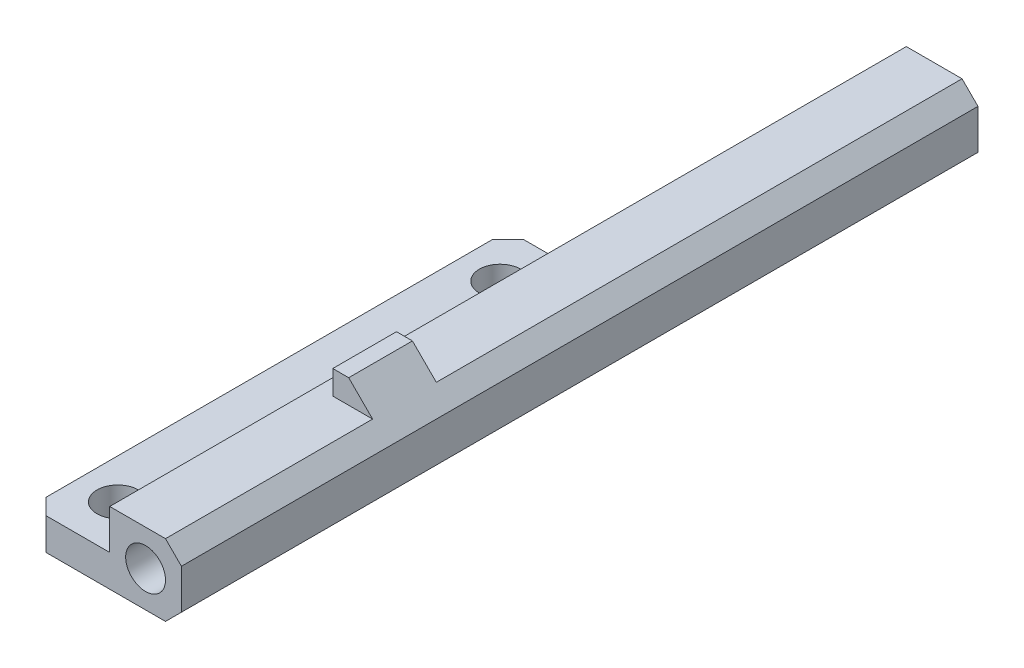
from build123d import *

# Parameters (mm, degrees)
SKETCH1_W           = 77.47
SKETCH1_H           = 127
BOSS_EXTRUDE1_DEPTH = 11.43
SKETCH2_R           = 3.175
CUT_EXTRUDE1_DEPTH  = 150.202030147
CUT_EXTRUDE2_DEPTH  = 150.202030147
SKETCH4_W           = 54.61
SKETCH4_H           = 6.35
CUT_EXTRUDE3_DEPTH  = 150.202030147
CHAMFER1_SIZE       = 2.54
SKETCH5_W           = 66.04
SKETCH5_H           = 50.8
CUT_EXTRUDE4_DEPTH  = 150.202030147
SKETCH6_W           = 53.34
SKETCH6_H           = 76.2
CUT_EXTRUDE5_DEPTH  = 150.202030147
SKETCH7_R           = 3.302
CUT_EXTRUDE6_DEPTH  = 149.899037606
CHAMFER2_SIZE       = 2.54
BOSS_EXTRUDE2_DEPTH = 5.08


with BuildPart() as part:
    # Sketch1 → Boss-Extrude1 (new body)
    with BuildSketch(Plane(origin=(0, 0, 0), x_dir=(1, 0, 0), z_dir=(0, 1, 0))):
        with Locations((38.735, 63.5)):
            Rectangle(SKETCH1_W, SKETCH1_H)
    extrude(amount=BOSS_EXTRUDE1_DEPTH)

    # Sketch2 → Cut-Extrude1 (cut, through all)
    with BuildSketch(Plane.XY):
        with Locations((5.715, 5.715)):
            Circle(SKETCH2_R)
        with Locations((71.755, 5.715)):
            Circle(SKETCH2_R)
    extrude(amount=-CUT_EXTRUDE1_DEPTH, mode=Mode.SUBTRACT)

    # Sketch3 → Cut-Extrude2 (cut, through all)
    with BuildSketch(Plane(origin=(0, 11.43, 0), x_dir=(1, 0, 0), z_dir=(0, 1, 0))):
        with BuildLine():
            Line((11.43, 127), (11.43, 88.9))
            ThreePointArc((11.43, 88.9), (15.149743879, 79.919743879), (24.13, 76.2))
            Line((24.13, 76.2), (53.34, 76.2))
            ThreePointArc((53.34, 76.2), (62.320256121, 79.919743879), (66.04, 88.9))
            Line((66.04, 88.9), (66.04, 127))
            Line((66.04, 127), (11.43, 127))
        make_face()
    extrude(amount=-CUT_EXTRUDE2_DEPTH, mode=Mode.SUBTRACT)

    # Sketch4 → Cut-Extrude3 (cut, through all)
    with BuildSketch(Plane(origin=(0, 0, -127), x_dir=(-1, 0, 0), z_dir=(0, 0, -1))):
        with Locations((-38.735, 8.255)):
            Rectangle(SKETCH4_W, SKETCH4_H)
    extrude(amount=-CUT_EXTRUDE3_DEPTH, mode=Mode.SUBTRACT)

    # Chamfer1
    chamfer1_edges = [part.edges().sort_by_distance(p)[0] for p in [
        (0, 0, -63.5),
        (0, 11.43, -63.5),
        (77.47, 0, -63.5),
        (77.47, 11.43, -63.5),
    ]]
    chamfer(chamfer1_edges, length=CHAMFER1_SIZE)

    # Sketch5 → Cut-Extrude4 (cut, through all)
    with BuildSketch(Plane(origin=(0, 11.43, 0), x_dir=(1, 0, 0), z_dir=(0, 1, 0))):
        with Locations((33.02, 101.6)):
            Rectangle(SKETCH5_W, SKETCH5_H)
    extrude(amount=-CUT_EXTRUDE4_DEPTH, mode=Mode.SUBTRACT)

    # Sketch6 → Cut-Extrude5 (cut, through all)
    with BuildSketch(Plane(origin=(0, 11.43, 0), x_dir=(1, 0, 0), z_dir=(0, 1, 0))):
        with Locations((26.67, 38.1)):
            Rectangle(SKETCH6_W, SKETCH6_H)
    extrude(amount=-CUT_EXTRUDE5_DEPTH, mode=Mode.SUBTRACT)

    # Sketch7 → Cut-Extrude6 (cut, through all)
    with BuildSketch(Plane(origin=(0, 5.08, 0), x_dir=(1, 0, 0), z_dir=(0, 1, 0))):
        with Locations((59.69, 68.58)):
            Circle(SKETCH7_R)
        with Locations((59.69, 7.62)):
            Circle(SKETCH7_R)
    extrude(amount=-CUT_EXTRUDE6_DEPTH, mode=Mode.SUBTRACT)

    # Chamfer2
    chamfer2_edges = [part.edges().sort_by_distance(p)[0] for p in [
        (53.34, 2.54, -76.2),
        (53.34, 2.54, 0),
    ]]
    chamfer(chamfer2_edges, length=CHAMFER2_SIZE)

    # Sketch8 → Boss-Extrude2 (add)
    with BuildSketch(Plane.XY.offset(-38.1)):
        Polygon((74.93, 11.43), (71.12, 15.24), (68.58, 15.24), (68.58, 11.43), align=None)
    boss_extrude2 = extrude(amount=BOSS_EXTRUDE2_DEPTH)

    # Mirror1: Boss-Extrude2 across plane
    add(boss_extrude2.mirror(Plane.XY.offset(-38.1)))


solid = part.part
